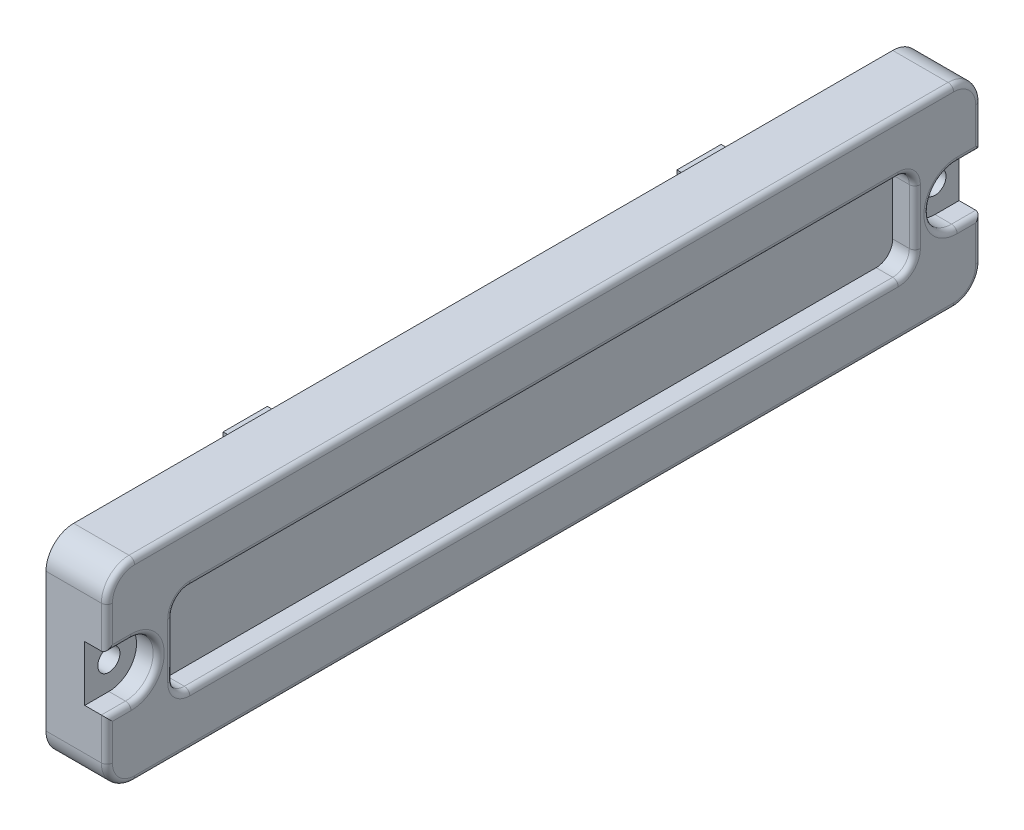
from build123d import *

# Parameters (mm, degrees)
EXTRUIR1_DEPTH            = 5.5
EXTRUIR2_DEPTH            = 2
EXTRUIR3_DEPTH            = 2
CROQUIS5_R                = 1
EXTRUIR4_DEPTH            = 41.608650556
REDONDEO1_R               = 0.5
VACIADO1_DEPTH            = 2
VACIADO1_START            = 2
VACIADO1_2_DEPTH          = 2
CROQUIS7_R                = 0.35
EXTRUIR6_DEPTH            = 0.1
MATRIZL1_START            = 1.9
MATRIZL1_OUTLINE_R        = 0.35
MATRIZL1_DEPTH            = 0.1
CROQUIS8_W                = 4
CROQUIS8_H                = 1
EXTRUIR7_DEPTH            = 5
SIMETR_A3_COPY_1_SKETCH_W = 4
SIMETR_A3_COPY_1_SKETCH_H = 1
SIMETR_A3_COPY_1_DEPTH    = 5


with BuildPart() as part:
    # Croquis2 → Extruir1 (new body)
    with BuildSketch(Plane(origin=(0, 0, 0), x_dir=(0, 0, -1), z_dir=(1, 0, 0))):
        with BuildLine():
            Line((-37, 8.75), (37, 8.75))
            ThreePointArc((37, 8.75), (38.767766953, 8.017766953), (39.5, 6.25))
            Line((39.5, 6.25), (39.5, -6.25))
            ThreePointArc((39.5, -6.25), (38.767766953, -8.017766953), (37, -8.75))
            Line((37, -8.75), (-37, -8.75))
            ThreePointArc((-37, -8.75), (-38.767766953, -8.017766953), (-39.5, -6.25))
            Line((-39.5, -6.25), (-39.5, 6.25))
            ThreePointArc((-39.5, 6.25), (-38.767766953, 8.017766953), (-37, 8.75))
        make_face()
    extrude(amount=EXTRUIR1_DEPTH)

    # Croquis3 → Extruir2 (cut)
    with BuildSketch(Plane(origin=(5.5, 0, 0), x_dir=(0, 0, -1), z_dir=(1, 0, 0))):
        with BuildLine():
            Line((-32, 4), (32, 4))
            ThreePointArc((32, 4), (33.060660172, 3.560660172), (33.5, 2.5))
            Line((33.5, 2.5), (33.5, -2.5))
            ThreePointArc((33.5, -2.5), (33.060660172, -3.560660172), (32, -4))
            Line((32, -4), (-32, -4))
            ThreePointArc((-32, -4), (-33.060660172, -3.560660172), (-33.5, -2.5))
            Line((-33.5, -2.5), (-33.5, 2.5))
            ThreePointArc((-33.5, 2.5), (-33.060660172, 3.560660172), (-32, 4))
        make_face()
    extrude(amount=-EXTRUIR2_DEPTH, mode=Mode.SUBTRACT)

    # Croquis4 → Extruir3 (cut)
    with BuildSketch(Plane(origin=(5.5, 0, 0), x_dir=(0, 0, -1), z_dir=(1, 0, 0))):
        with BuildLine():
            Line((-39.5, 2.5), (-37.32, 2.5))
            ThreePointArc((-37.32, 2.5), (-34.82, 0), (-37.32, -2.5))
            Line((-37.32, -2.5), (-39.5, -2.5))
            Line((-39.5, -2.5), (-39.5, 2.5))
        make_face()
    extruir3 = extrude(amount=-EXTRUIR3_DEPTH, mode=Mode.SUBTRACT)

    # Croquis5 → Extruir4 (cut, through all)
    with BuildSketch(Plane(origin=(3.5, 0, 0), x_dir=(0, 0, -1), z_dir=(1, 0, 0))):
        with Locations((-37.32, 0)):
            Circle(CROQUIS5_R)
    extruir4 = extrude(amount=-EXTRUIR4_DEPTH, mode=Mode.SUBTRACT)

    # Simetría1: Extruir3, Extruir4 across plane
    add(extruir3.mirror(Plane.XY), mode=Mode.SUBTRACT)
    add(extruir4.mirror(Plane.XY), mode=Mode.SUBTRACT)

    # Redondeo1
    redondeo1_edges = [part.edges().sort_by_distance(p)[0] for p in [
        (5.5, -8.017766953, 38.767766953),
        (5.5, -8.75, 0),
        (5.5, -8.017766953, -38.767766953),
        (5.5, -4.375, -39.5),
        (5.5, 8.017766953, -38.767766953),
        (5.5, 8.75, 0),
        (5.5, 8.017766953, 38.767766953),
        (5.5, 3.560660172, 33.060660172),
        (5.5, 0, 33.5),
        (5.5, -3.560660172, 33.060660172),
        (5.5, -4, 0),
        (5.5, -3.560660172, -33.060660172),
        (5.5, 0, -33.5),
        (5.5, 3.560660172, -33.060660172),
        (5.5, 4, 0),
        (5.5, -4.375, 39.5),
        (5.5, -2.5, 38.41),
        (5.5, 0, 34.82),
        (5.5, 2.5, 38.41),
        (5.5, 4.375, 39.5),
        (5.5, 4.375, -39.5),
        (5.5, -2.5, -38.41),
        (5.5, 0, -34.82),
        (5.5, 2.5, -38.41),
    ]]
    fillet(redondeo1_edges, radius=REDONDEO1_R)

    # Vaciado1: read off the stored shape, not the designer's step
    # Vaciado1 outline → Vaciado1 (cut)
    with BuildSketch(Plane.YZ):
        with BuildLine():
            Line((-2.405743128, 38), (-6.25, 38))
            ThreePointArc((-6.25, 38), (-6.957106781, 37.707106781), (-7.25, 37))
            Line((-7.25, 37), (-7.25, -37))
            ThreePointArc((-7.25, -37), (-6.957106781, -37.707106781), (-6.25, -38))
            Line((-6.25, -38), (-2.405743128, -38))
            ThreePointArc((-2.405743128, -38), (0, -34.82), (2.405743128, -38))
            Line((2.405743128, -38), (6.25, -38))
            ThreePointArc((6.25, -38), (6.957106781, -37.707106781), (7.25, -37))
            Line((7.25, -37), (7.25, 37))
            ThreePointArc((7.25, 37), (6.957106781, 37.707106781), (6.25, 38))
            Line((6.25, 38), (2.405743128, 38))
            ThreePointArc((2.405743128, 38), (0, 34.82), (-2.405743128, 38))
        make_face()
    extrude(amount=VACIADO1_DEPTH, mode=Mode.SUBTRACT)

    # Vaciado1 2 outline → Vaciado1 2 (cut)
    with BuildSketch(Plane.YZ.offset(VACIADO1_START)):
        with BuildLine():
            ThreePointArc((-4, -37.32), (-3.794262159, -36.053676712), (-3.198212665, -34.917618734))
            ThreePointArc((-3.198212665, -34.917618734), (-4.855274718, -33.858139124), (-5.5, -32))
            Line((-5.5, -32), (-5.5, 32))
            ThreePointArc((-5.5, 32), (-4.855274718, 33.858139124), (-3.198212665, 34.917618734))
            ThreePointArc((-3.198212665, 34.917618734), (-3.794262159, 36.053676712), (-4, 37.32))
            Line((-4, 37.32), (-4, 38))
            Line((-4, 38), (-6.25, 38))
            ThreePointArc((-6.25, 38), (-6.957106781, 37.707106781), (-7.25, 37))
            Line((-7.25, 37), (-7.25, -37))
            ThreePointArc((-7.25, -37), (-6.957106781, -37.707106781), (-6.25, -38))
            Line((-6.25, -38), (-4, -38))
            Line((-4, -38), (-4, -37.32))
        make_face()
        with BuildLine():
            Line((4, -37.32), (4, -38))
            Line((4, -38), (6.25, -38))
            ThreePointArc((6.25, -38), (6.957106781, -37.707106781), (7.25, -37))
            Line((7.25, -37), (7.25, 37))
            ThreePointArc((7.25, 37), (6.957106781, 37.707106781), (6.25, 38))
            Line((6.25, 38), (4, 38))
            Line((4, 38), (4, 37.32))
            ThreePointArc((4, 37.32), (3.794262159, 36.053676712), (3.198212665, 34.917618734))
            ThreePointArc((3.198212665, 34.917618734), (4.855274718, 33.858139124), (5.5, 32))
            Line((5.5, 32), (5.5, -32))
            ThreePointArc((5.5, -32), (4.855274718, -33.858139124), (3.198212665, -34.917618734))
            ThreePointArc((3.198212665, -34.917618734), (3.794262159, -36.053676712), (4, -37.32))
        make_face()
    extrude(amount=VACIADO1_2_DEPTH, mode=Mode.SUBTRACT)

    # Croquis7 → Extruir6 (add)
    with BuildSketch(Plane.ZY.offset(-2)):
        with Locations((-31.830162844, 2.25)):
            Circle(CROQUIS7_R)
    extrude(amount=EXTRUIR6_DEPTH)

    # MatrizL1: read off the stored shape, not the designer's step
    # MatrizL1 outline → MatrizL1 (add)
    with BuildSketch(Plane.YZ.offset(MATRIZL1_START)):
        with Locations((2.25, -30.830162844)):
            Circle(MATRIZL1_OUTLINE_R)
        with Locations((2.25, -29.830162844)):
            Circle(MATRIZL1_OUTLINE_R)
        with Locations((2.25, -28.830162844)):
            Circle(MATRIZL1_OUTLINE_R)
        with Locations((2.25, -27.830162844)):
            Circle(MATRIZL1_OUTLINE_R)
        with Locations((2.25, -26.830162844)):
            Circle(MATRIZL1_OUTLINE_R)
        with Locations((2.25, -25.830162844)):
            Circle(MATRIZL1_OUTLINE_R)
        with Locations((2.25, -24.830162844)):
            Circle(MATRIZL1_OUTLINE_R)
        with Locations((2.25, -23.830162844)):
            Circle(MATRIZL1_OUTLINE_R)
        with Locations((2.25, -22.830162844)):
            Circle(MATRIZL1_OUTLINE_R)
        with Locations((2.25, -21.830162844)):
            Circle(MATRIZL1_OUTLINE_R)
        with Locations((2.25, -20.830162844)):
            Circle(MATRIZL1_OUTLINE_R)
        with Locations((2.25, -19.830162844)):
            Circle(MATRIZL1_OUTLINE_R)
        with Locations((2.25, -18.830162844)):
            Circle(MATRIZL1_OUTLINE_R)
        with Locations((2.25, -17.830162844)):
            Circle(MATRIZL1_OUTLINE_R)
        with Locations((2.25, -16.830162844)):
            Circle(MATRIZL1_OUTLINE_R)
        with Locations((2.25, -15.830162844)):
            Circle(MATRIZL1_OUTLINE_R)
        with Locations((2.25, -14.830162844)):
            Circle(MATRIZL1_OUTLINE_R)
        with Locations((2.25, -13.830162844)):
            Circle(MATRIZL1_OUTLINE_R)
        with Locations((2.25, -12.830162844)):
            Circle(MATRIZL1_OUTLINE_R)
        with Locations((2.25, -11.830162844)):
            Circle(MATRIZL1_OUTLINE_R)
        with Locations((2.25, -10.830162844)):
            Circle(MATRIZL1_OUTLINE_R)
        with Locations((2.25, -9.830162844)):
            Circle(MATRIZL1_OUTLINE_R)
        with Locations((2.25, -8.830162844)):
            Circle(MATRIZL1_OUTLINE_R)
        with Locations((2.25, -7.830162844)):
            Circle(MATRIZL1_OUTLINE_R)
        with Locations((2.25, -6.830162844)):
            Circle(MATRIZL1_OUTLINE_R)
        with Locations((2.25, -5.830162844)):
            Circle(MATRIZL1_OUTLINE_R)
        with Locations((2.25, -4.830162844)):
            Circle(MATRIZL1_OUTLINE_R)
        with Locations((2.25, -3.830162844)):
            Circle(MATRIZL1_OUTLINE_R)
        with Locations((2.25, -2.830162844)):
            Circle(MATRIZL1_OUTLINE_R)
        with Locations((2.25, -1.830162844)):
            Circle(MATRIZL1_OUTLINE_R)
        with Locations((2.25, -0.830162844)):
            Circle(MATRIZL1_OUTLINE_R)
        with Locations((2.25, 0.169837156)):
            Circle(MATRIZL1_OUTLINE_R)
        with Locations((2.25, 1.169837156)):
            Circle(MATRIZL1_OUTLINE_R)
        with Locations((2.25, 2.169837156)):
            Circle(MATRIZL1_OUTLINE_R)
        with Locations((2.25, 3.169837156)):
            Circle(MATRIZL1_OUTLINE_R)
        with Locations((2.25, 4.169837156)):
            Circle(MATRIZL1_OUTLINE_R)
        with Locations((2.25, 5.169837156)):
            Circle(MATRIZL1_OUTLINE_R)
        with Locations((2.25, 6.169837156)):
            Circle(MATRIZL1_OUTLINE_R)
        with Locations((2.25, 7.169837156)):
            Circle(MATRIZL1_OUTLINE_R)
        with Locations((2.25, 8.169837156)):
            Circle(MATRIZL1_OUTLINE_R)
        with Locations((2.25, 9.169837156)):
            Circle(MATRIZL1_OUTLINE_R)
        with Locations((2.25, 10.169837156)):
            Circle(MATRIZL1_OUTLINE_R)
        with Locations((2.25, 11.169837156)):
            Circle(MATRIZL1_OUTLINE_R)
        with Locations((2.25, 12.169837156)):
            Circle(MATRIZL1_OUTLINE_R)
        with Locations((2.25, 13.169837156)):
            Circle(MATRIZL1_OUTLINE_R)
        with Locations((2.25, 14.169837156)):
            Circle(MATRIZL1_OUTLINE_R)
        with Locations((2.25, 15.169837156)):
            Circle(MATRIZL1_OUTLINE_R)
        with Locations((2.25, 16.169837156)):
            Circle(MATRIZL1_OUTLINE_R)
        with Locations((2.25, 17.169837156)):
            Circle(MATRIZL1_OUTLINE_R)
        with Locations((2.25, 18.169837156)):
            Circle(MATRIZL1_OUTLINE_R)
        with Locations((2.25, 19.169837156)):
            Circle(MATRIZL1_OUTLINE_R)
        with Locations((2.25, 20.169837156)):
            Circle(MATRIZL1_OUTLINE_R)
        with Locations((2.25, 21.169837156)):
            Circle(MATRIZL1_OUTLINE_R)
        with Locations((2.25, 22.169837156)):
            Circle(MATRIZL1_OUTLINE_R)
        with Locations((2.25, 23.169837156)):
            Circle(MATRIZL1_OUTLINE_R)
        with Locations((2.25, 24.169837156)):
            Circle(MATRIZL1_OUTLINE_R)
        with Locations((2.25, 25.169837156)):
            Circle(MATRIZL1_OUTLINE_R)
        with Locations((2.25, 26.169837156)):
            Circle(MATRIZL1_OUTLINE_R)
        with Locations((2.25, 27.169837156)):
            Circle(MATRIZL1_OUTLINE_R)
        with Locations((2.25, 28.169837156)):
            Circle(MATRIZL1_OUTLINE_R)
        with Locations((2.25, 29.169837156)):
            Circle(MATRIZL1_OUTLINE_R)
        with Locations((2.25, 30.169837156)):
            Circle(MATRIZL1_OUTLINE_R)
        with Locations((2.25, 31.169837156)):
            Circle(MATRIZL1_OUTLINE_R)
        with Locations((1.25, -31.830162844)):
            Circle(MATRIZL1_OUTLINE_R)
        with Locations((1.25, -30.830162844)):
            Circle(MATRIZL1_OUTLINE_R)
        with Locations((1.25, -29.830162844)):
            Circle(MATRIZL1_OUTLINE_R)
        with Locations((1.25, -28.830162844)):
            Circle(MATRIZL1_OUTLINE_R)
        with Locations((1.25, -27.830162844)):
            Circle(MATRIZL1_OUTLINE_R)
        with Locations((1.25, -26.830162844)):
            Circle(MATRIZL1_OUTLINE_R)
        with Locations((1.25, -25.830162844)):
            Circle(MATRIZL1_OUTLINE_R)
        with Locations((1.25, -24.830162844)):
            Circle(MATRIZL1_OUTLINE_R)
        with Locations((1.25, -23.830162844)):
            Circle(MATRIZL1_OUTLINE_R)
        with Locations((1.25, -22.830162844)):
            Circle(MATRIZL1_OUTLINE_R)
        with Locations((1.25, -21.830162844)):
            Circle(MATRIZL1_OUTLINE_R)
        with Locations((1.25, -20.830162844)):
            Circle(MATRIZL1_OUTLINE_R)
        with Locations((1.25, -19.830162844)):
            Circle(MATRIZL1_OUTLINE_R)
        with Locations((1.25, -18.830162844)):
            Circle(MATRIZL1_OUTLINE_R)
        with Locations((1.25, -17.830162844)):
            Circle(MATRIZL1_OUTLINE_R)
        with Locations((1.25, -16.830162844)):
            Circle(MATRIZL1_OUTLINE_R)
        with Locations((1.25, -15.830162844)):
            Circle(MATRIZL1_OUTLINE_R)
        with Locations((1.25, -14.830162844)):
            Circle(MATRIZL1_OUTLINE_R)
        with Locations((1.25, -13.830162844)):
            Circle(MATRIZL1_OUTLINE_R)
        with Locations((1.25, -12.830162844)):
            Circle(MATRIZL1_OUTLINE_R)
        with Locations((1.25, -11.830162844)):
            Circle(MATRIZL1_OUTLINE_R)
        with Locations((1.25, -10.830162844)):
            Circle(MATRIZL1_OUTLINE_R)
        with Locations((1.25, -9.830162844)):
            Circle(MATRIZL1_OUTLINE_R)
        with Locations((1.25, -8.830162844)):
            Circle(MATRIZL1_OUTLINE_R)
        with Locations((1.25, -7.830162844)):
            Circle(MATRIZL1_OUTLINE_R)
        with Locations((1.25, -6.830162844)):
            Circle(MATRIZL1_OUTLINE_R)
        with Locations((1.25, -5.830162844)):
            Circle(MATRIZL1_OUTLINE_R)
        with Locations((1.25, -4.830162844)):
            Circle(MATRIZL1_OUTLINE_R)
        with Locations((1.25, -3.830162844)):
            Circle(MATRIZL1_OUTLINE_R)
        with Locations((1.25, -2.830162844)):
            Circle(MATRIZL1_OUTLINE_R)
        with Locations((1.25, -1.830162844)):
            Circle(MATRIZL1_OUTLINE_R)
        with Locations((1.25, -0.830162844)):
            Circle(MATRIZL1_OUTLINE_R)
        with Locations((1.25, 0.169837156)):
            Circle(MATRIZL1_OUTLINE_R)
        with Locations((1.25, 1.169837156)):
            Circle(MATRIZL1_OUTLINE_R)
        with Locations((1.25, 2.169837156)):
            Circle(MATRIZL1_OUTLINE_R)
        with Locations((1.25, 3.169837156)):
            Circle(MATRIZL1_OUTLINE_R)
        with Locations((1.25, 4.169837156)):
            Circle(MATRIZL1_OUTLINE_R)
        with Locations((1.25, 5.169837156)):
            Circle(MATRIZL1_OUTLINE_R)
        with Locations((1.25, 6.169837156)):
            Circle(MATRIZL1_OUTLINE_R)
        with Locations((1.25, 7.169837156)):
            Circle(MATRIZL1_OUTLINE_R)
        with Locations((1.25, 8.169837156)):
            Circle(MATRIZL1_OUTLINE_R)
        with Locations((1.25, 9.169837156)):
            Circle(MATRIZL1_OUTLINE_R)
        with Locations((1.25, 10.169837156)):
            Circle(MATRIZL1_OUTLINE_R)
        with Locations((1.25, 11.169837156)):
            Circle(MATRIZL1_OUTLINE_R)
        with Locations((1.25, 12.169837156)):
            Circle(MATRIZL1_OUTLINE_R)
        with Locations((1.25, 13.169837156)):
            Circle(MATRIZL1_OUTLINE_R)
        with Locations((1.25, 14.169837156)):
            Circle(MATRIZL1_OUTLINE_R)
        with Locations((1.25, 15.169837156)):
            Circle(MATRIZL1_OUTLINE_R)
        with Locations((1.25, 16.169837156)):
            Circle(MATRIZL1_OUTLINE_R)
        with Locations((1.25, 17.169837156)):
            Circle(MATRIZL1_OUTLINE_R)
        with Locations((1.25, 18.169837156)):
            Circle(MATRIZL1_OUTLINE_R)
        with Locations((1.25, 19.169837156)):
            Circle(MATRIZL1_OUTLINE_R)
        with Locations((1.25, 20.169837156)):
            Circle(MATRIZL1_OUTLINE_R)
        with Locations((1.25, 21.169837156)):
            Circle(MATRIZL1_OUTLINE_R)
        with Locations((1.25, 22.169837156)):
            Circle(MATRIZL1_OUTLINE_R)
        with Locations((1.25, 23.169837156)):
            Circle(MATRIZL1_OUTLINE_R)
        with Locations((1.25, 24.169837156)):
            Circle(MATRIZL1_OUTLINE_R)
        with Locations((1.25, 25.169837156)):
            Circle(MATRIZL1_OUTLINE_R)
        with Locations((1.25, 26.169837156)):
            Circle(MATRIZL1_OUTLINE_R)
        with Locations((1.25, 27.169837156)):
            Circle(MATRIZL1_OUTLINE_R)
        with Locations((1.25, 28.169837156)):
            Circle(MATRIZL1_OUTLINE_R)
        with Locations((1.25, 29.169837156)):
            Circle(MATRIZL1_OUTLINE_R)
        with Locations((1.25, 30.169837156)):
            Circle(MATRIZL1_OUTLINE_R)
        with Locations((1.25, 31.169837156)):
            Circle(MATRIZL1_OUTLINE_R)
        with Locations((0.25, -31.830162844)):
            Circle(MATRIZL1_OUTLINE_R)
        with Locations((0.25, -30.830162844)):
            Circle(MATRIZL1_OUTLINE_R)
        with Locations((0.25, -29.830162844)):
            Circle(MATRIZL1_OUTLINE_R)
        with Locations((0.25, -28.830162844)):
            Circle(MATRIZL1_OUTLINE_R)
        with Locations((0.25, -27.830162844)):
            Circle(MATRIZL1_OUTLINE_R)
        with Locations((0.25, -26.830162844)):
            Circle(MATRIZL1_OUTLINE_R)
        with Locations((0.25, -25.830162844)):
            Circle(MATRIZL1_OUTLINE_R)
        with Locations((0.25, -24.830162844)):
            Circle(MATRIZL1_OUTLINE_R)
        with Locations((0.25, -23.830162844)):
            Circle(MATRIZL1_OUTLINE_R)
        with Locations((0.25, -22.830162844)):
            Circle(MATRIZL1_OUTLINE_R)
        with Locations((0.25, -21.830162844)):
            Circle(MATRIZL1_OUTLINE_R)
        with Locations((0.25, -20.830162844)):
            Circle(MATRIZL1_OUTLINE_R)
        with Locations((0.25, -19.830162844)):
            Circle(MATRIZL1_OUTLINE_R)
        with Locations((0.25, -18.830162844)):
            Circle(MATRIZL1_OUTLINE_R)
        with Locations((0.25, -17.830162844)):
            Circle(MATRIZL1_OUTLINE_R)
        with Locations((0.25, -16.830162844)):
            Circle(MATRIZL1_OUTLINE_R)
        with Locations((0.25, -15.830162844)):
            Circle(MATRIZL1_OUTLINE_R)
        with Locations((0.25, -14.830162844)):
            Circle(MATRIZL1_OUTLINE_R)
        with Locations((0.25, -13.830162844)):
            Circle(MATRIZL1_OUTLINE_R)
        with Locations((0.25, -12.830162844)):
            Circle(MATRIZL1_OUTLINE_R)
        with Locations((0.25, -11.830162844)):
            Circle(MATRIZL1_OUTLINE_R)
        with Locations((0.25, -10.830162844)):
            Circle(MATRIZL1_OUTLINE_R)
        with Locations((0.25, -9.830162844)):
            Circle(MATRIZL1_OUTLINE_R)
        with Locations((0.25, -8.830162844)):
            Circle(MATRIZL1_OUTLINE_R)
        with Locations((0.25, -7.830162844)):
            Circle(MATRIZL1_OUTLINE_R)
        with Locations((0.25, -6.830162844)):
            Circle(MATRIZL1_OUTLINE_R)
        with Locations((0.25, -5.830162844)):
            Circle(MATRIZL1_OUTLINE_R)
        with Locations((0.25, -4.830162844)):
            Circle(MATRIZL1_OUTLINE_R)
        with Locations((0.25, -3.830162844)):
            Circle(MATRIZL1_OUTLINE_R)
        with Locations((0.25, -2.830162844)):
            Circle(MATRIZL1_OUTLINE_R)
        with Locations((0.25, -1.830162844)):
            Circle(MATRIZL1_OUTLINE_R)
        with Locations((0.25, -0.830162844)):
            Circle(MATRIZL1_OUTLINE_R)
        with Locations((0.25, 0.169837156)):
            Circle(MATRIZL1_OUTLINE_R)
        with Locations((0.25, 1.169837156)):
            Circle(MATRIZL1_OUTLINE_R)
        with Locations((0.25, 2.169837156)):
            Circle(MATRIZL1_OUTLINE_R)
        with Locations((0.25, 3.169837156)):
            Circle(MATRIZL1_OUTLINE_R)
        with Locations((0.25, 4.169837156)):
            Circle(MATRIZL1_OUTLINE_R)
        with Locations((0.25, 5.169837156)):
            Circle(MATRIZL1_OUTLINE_R)
        with Locations((0.25, 6.169837156)):
            Circle(MATRIZL1_OUTLINE_R)
        with Locations((0.25, 7.169837156)):
            Circle(MATRIZL1_OUTLINE_R)
        with Locations((0.25, 8.169837156)):
            Circle(MATRIZL1_OUTLINE_R)
        with Locations((0.25, 9.169837156)):
            Circle(MATRIZL1_OUTLINE_R)
        with Locations((0.25, 10.169837156)):
            Circle(MATRIZL1_OUTLINE_R)
        with Locations((0.25, 11.169837156)):
            Circle(MATRIZL1_OUTLINE_R)
        with Locations((0.25, 12.169837156)):
            Circle(MATRIZL1_OUTLINE_R)
        with Locations((0.25, 13.169837156)):
            Circle(MATRIZL1_OUTLINE_R)
        with Locations((0.25, 14.169837156)):
            Circle(MATRIZL1_OUTLINE_R)
        with Locations((0.25, 15.169837156)):
            Circle(MATRIZL1_OUTLINE_R)
        with Locations((0.25, 16.169837156)):
            Circle(MATRIZL1_OUTLINE_R)
        with Locations((0.25, 17.169837156)):
            Circle(MATRIZL1_OUTLINE_R)
        with Locations((0.25, 18.169837156)):
            Circle(MATRIZL1_OUTLINE_R)
        with Locations((0.25, 19.169837156)):
            Circle(MATRIZL1_OUTLINE_R)
        with Locations((0.25, 20.169837156)):
            Circle(MATRIZL1_OUTLINE_R)
        with Locations((0.25, 21.169837156)):
            Circle(MATRIZL1_OUTLINE_R)
        with Locations((0.25, 22.169837156)):
            Circle(MATRIZL1_OUTLINE_R)
        with Locations((0.25, 23.169837156)):
            Circle(MATRIZL1_OUTLINE_R)
        with Locations((0.25, 24.169837156)):
            Circle(MATRIZL1_OUTLINE_R)
        with Locations((0.25, 25.169837156)):
            Circle(MATRIZL1_OUTLINE_R)
        with Locations((0.25, 26.169837156)):
            Circle(MATRIZL1_OUTLINE_R)
        with Locations((0.25, 27.169837156)):
            Circle(MATRIZL1_OUTLINE_R)
        with Locations((0.25, 28.169837156)):
            Circle(MATRIZL1_OUTLINE_R)
        with Locations((0.25, 29.169837156)):
            Circle(MATRIZL1_OUTLINE_R)
        with Locations((0.25, 30.169837156)):
            Circle(MATRIZL1_OUTLINE_R)
        with Locations((0.25, 31.169837156)):
            Circle(MATRIZL1_OUTLINE_R)
        with Locations((-0.75, -31.830162844)):
            Circle(MATRIZL1_OUTLINE_R)
        with Locations((-0.75, -30.830162844)):
            Circle(MATRIZL1_OUTLINE_R)
        with Locations((-0.75, -29.830162844)):
            Circle(MATRIZL1_OUTLINE_R)
        with Locations((-0.75, -28.830162844)):
            Circle(MATRIZL1_OUTLINE_R)
        with Locations((-0.75, -27.830162844)):
            Circle(MATRIZL1_OUTLINE_R)
        with Locations((-0.75, -26.830162844)):
            Circle(MATRIZL1_OUTLINE_R)
        with Locations((-0.75, -25.830162844)):
            Circle(MATRIZL1_OUTLINE_R)
        with Locations((-0.75, -24.830162844)):
            Circle(MATRIZL1_OUTLINE_R)
        with Locations((-0.75, -23.830162844)):
            Circle(MATRIZL1_OUTLINE_R)
        with Locations((-0.75, -22.830162844)):
            Circle(MATRIZL1_OUTLINE_R)
        with Locations((-0.75, -21.830162844)):
            Circle(MATRIZL1_OUTLINE_R)
        with Locations((-0.75, -20.830162844)):
            Circle(MATRIZL1_OUTLINE_R)
        with Locations((-0.75, -19.830162844)):
            Circle(MATRIZL1_OUTLINE_R)
        with Locations((-0.75, -18.830162844)):
            Circle(MATRIZL1_OUTLINE_R)
        with Locations((-0.75, -17.830162844)):
            Circle(MATRIZL1_OUTLINE_R)
        with Locations((-0.75, -16.830162844)):
            Circle(MATRIZL1_OUTLINE_R)
        with Locations((-0.75, -15.830162844)):
            Circle(MATRIZL1_OUTLINE_R)
        with Locations((-0.75, -14.830162844)):
            Circle(MATRIZL1_OUTLINE_R)
        with Locations((-0.75, -13.830162844)):
            Circle(MATRIZL1_OUTLINE_R)
        with Locations((-0.75, -12.830162844)):
            Circle(MATRIZL1_OUTLINE_R)
        with Locations((-0.75, -11.830162844)):
            Circle(MATRIZL1_OUTLINE_R)
        with Locations((-0.75, -10.830162844)):
            Circle(MATRIZL1_OUTLINE_R)
        with Locations((-0.75, -9.830162844)):
            Circle(MATRIZL1_OUTLINE_R)
        with Locations((-0.75, -8.830162844)):
            Circle(MATRIZL1_OUTLINE_R)
        with Locations((-0.75, -7.830162844)):
            Circle(MATRIZL1_OUTLINE_R)
        with Locations((-0.75, -6.830162844)):
            Circle(MATRIZL1_OUTLINE_R)
        with Locations((-0.75, -5.830162844)):
            Circle(MATRIZL1_OUTLINE_R)
        with Locations((-0.75, -4.830162844)):
            Circle(MATRIZL1_OUTLINE_R)
        with Locations((-0.75, -3.830162844)):
            Circle(MATRIZL1_OUTLINE_R)
        with Locations((-0.75, -2.830162844)):
            Circle(MATRIZL1_OUTLINE_R)
        with Locations((-0.75, -1.830162844)):
            Circle(MATRIZL1_OUTLINE_R)
        with Locations((-0.75, -0.830162844)):
            Circle(MATRIZL1_OUTLINE_R)
        with Locations((-0.75, 0.169837156)):
            Circle(MATRIZL1_OUTLINE_R)
        with Locations((-0.75, 1.169837156)):
            Circle(MATRIZL1_OUTLINE_R)
        with Locations((-0.75, 2.169837156)):
            Circle(MATRIZL1_OUTLINE_R)
        with Locations((-0.75, 3.169837156)):
            Circle(MATRIZL1_OUTLINE_R)
        with Locations((-0.75, 4.169837156)):
            Circle(MATRIZL1_OUTLINE_R)
        with Locations((-0.75, 5.169837156)):
            Circle(MATRIZL1_OUTLINE_R)
        with Locations((-0.75, 6.169837156)):
            Circle(MATRIZL1_OUTLINE_R)
        with Locations((-0.75, 7.169837156)):
            Circle(MATRIZL1_OUTLINE_R)
        with Locations((-0.75, 8.169837156)):
            Circle(MATRIZL1_OUTLINE_R)
        with Locations((-0.75, 9.169837156)):
            Circle(MATRIZL1_OUTLINE_R)
        with Locations((-0.75, 10.169837156)):
            Circle(MATRIZL1_OUTLINE_R)
        with Locations((-0.75, 11.169837156)):
            Circle(MATRIZL1_OUTLINE_R)
        with Locations((-0.75, 12.169837156)):
            Circle(MATRIZL1_OUTLINE_R)
        with Locations((-0.75, 13.169837156)):
            Circle(MATRIZL1_OUTLINE_R)
        with Locations((-0.75, 14.169837156)):
            Circle(MATRIZL1_OUTLINE_R)
        with Locations((-0.75, 15.169837156)):
            Circle(MATRIZL1_OUTLINE_R)
        with Locations((-0.75, 16.169837156)):
            Circle(MATRIZL1_OUTLINE_R)
        with Locations((-0.75, 17.169837156)):
            Circle(MATRIZL1_OUTLINE_R)
        with Locations((-0.75, 18.169837156)):
            Circle(MATRIZL1_OUTLINE_R)
        with Locations((-0.75, 19.169837156)):
            Circle(MATRIZL1_OUTLINE_R)
        with Locations((-0.75, 20.169837156)):
            Circle(MATRIZL1_OUTLINE_R)
        with Locations((-0.75, 21.169837156)):
            Circle(MATRIZL1_OUTLINE_R)
        with Locations((-0.75, 22.169837156)):
            Circle(MATRIZL1_OUTLINE_R)
        with Locations((-0.75, 23.169837156)):
            Circle(MATRIZL1_OUTLINE_R)
        with Locations((-0.75, 24.169837156)):
            Circle(MATRIZL1_OUTLINE_R)
        with Locations((-0.75, 25.169837156)):
            Circle(MATRIZL1_OUTLINE_R)
        with Locations((-0.75, 26.169837156)):
            Circle(MATRIZL1_OUTLINE_R)
        with Locations((-0.75, 27.169837156)):
            Circle(MATRIZL1_OUTLINE_R)
        with Locations((-0.75, 28.169837156)):
            Circle(MATRIZL1_OUTLINE_R)
        with Locations((-0.75, 29.169837156)):
            Circle(MATRIZL1_OUTLINE_R)
        with Locations((-0.75, 30.169837156)):
            Circle(MATRIZL1_OUTLINE_R)
        with Locations((-0.75, 31.169837156)):
            Circle(MATRIZL1_OUTLINE_R)
        with Locations((-1.75, -31.830162844)):
            Circle(MATRIZL1_OUTLINE_R)
        with Locations((-1.75, -30.830162844)):
            Circle(MATRIZL1_OUTLINE_R)
        with Locations((-1.75, -29.830162844)):
            Circle(MATRIZL1_OUTLINE_R)
        with Locations((-1.75, -28.830162844)):
            Circle(MATRIZL1_OUTLINE_R)
        with Locations((-1.75, -27.830162844)):
            Circle(MATRIZL1_OUTLINE_R)
        with Locations((-1.75, -26.830162844)):
            Circle(MATRIZL1_OUTLINE_R)
        with Locations((-1.75, -25.830162844)):
            Circle(MATRIZL1_OUTLINE_R)
        with Locations((-1.75, -24.830162844)):
            Circle(MATRIZL1_OUTLINE_R)
        with Locations((-1.75, -23.830162844)):
            Circle(MATRIZL1_OUTLINE_R)
        with Locations((-1.75, -22.830162844)):
            Circle(MATRIZL1_OUTLINE_R)
        with Locations((-1.75, -21.830162844)):
            Circle(MATRIZL1_OUTLINE_R)
        with Locations((-1.75, -20.830162844)):
            Circle(MATRIZL1_OUTLINE_R)
        with Locations((-1.75, -19.830162844)):
            Circle(MATRIZL1_OUTLINE_R)
        with Locations((-1.75, -18.830162844)):
            Circle(MATRIZL1_OUTLINE_R)
        with Locations((-1.75, -17.830162844)):
            Circle(MATRIZL1_OUTLINE_R)
        with Locations((-1.75, -16.830162844)):
            Circle(MATRIZL1_OUTLINE_R)
        with Locations((-1.75, -15.830162844)):
            Circle(MATRIZL1_OUTLINE_R)
        with Locations((-1.75, -14.830162844)):
            Circle(MATRIZL1_OUTLINE_R)
        with Locations((-1.75, -13.830162844)):
            Circle(MATRIZL1_OUTLINE_R)
        with Locations((-1.75, -12.830162844)):
            Circle(MATRIZL1_OUTLINE_R)
        with Locations((-1.75, -11.830162844)):
            Circle(MATRIZL1_OUTLINE_R)
        with Locations((-1.75, -10.830162844)):
            Circle(MATRIZL1_OUTLINE_R)
        with Locations((-1.75, -9.830162844)):
            Circle(MATRIZL1_OUTLINE_R)
        with Locations((-1.75, -8.830162844)):
            Circle(MATRIZL1_OUTLINE_R)
        with Locations((-1.75, -7.830162844)):
            Circle(MATRIZL1_OUTLINE_R)
        with Locations((-1.75, -6.830162844)):
            Circle(MATRIZL1_OUTLINE_R)
        with Locations((-1.75, -5.830162844)):
            Circle(MATRIZL1_OUTLINE_R)
        with Locations((-1.75, -4.830162844)):
            Circle(MATRIZL1_OUTLINE_R)
        with Locations((-1.75, -3.830162844)):
            Circle(MATRIZL1_OUTLINE_R)
        with Locations((-1.75, -2.830162844)):
            Circle(MATRIZL1_OUTLINE_R)
        with Locations((-1.75, -1.830162844)):
            Circle(MATRIZL1_OUTLINE_R)
        with Locations((-1.75, -0.830162844)):
            Circle(MATRIZL1_OUTLINE_R)
        with Locations((-1.75, 0.169837156)):
            Circle(MATRIZL1_OUTLINE_R)
        with Locations((-1.75, 1.169837156)):
            Circle(MATRIZL1_OUTLINE_R)
        with Locations((-1.75, 2.169837156)):
            Circle(MATRIZL1_OUTLINE_R)
        with Locations((-1.75, 3.169837156)):
            Circle(MATRIZL1_OUTLINE_R)
        with Locations((-1.75, 4.169837156)):
            Circle(MATRIZL1_OUTLINE_R)
        with Locations((-1.75, 5.169837156)):
            Circle(MATRIZL1_OUTLINE_R)
        with Locations((-1.75, 6.169837156)):
            Circle(MATRIZL1_OUTLINE_R)
        with Locations((-1.75, 7.169837156)):
            Circle(MATRIZL1_OUTLINE_R)
        with Locations((-1.75, 8.169837156)):
            Circle(MATRIZL1_OUTLINE_R)
        with Locations((-1.75, 9.169837156)):
            Circle(MATRIZL1_OUTLINE_R)
        with Locations((-1.75, 10.169837156)):
            Circle(MATRIZL1_OUTLINE_R)
        with Locations((-1.75, 11.169837156)):
            Circle(MATRIZL1_OUTLINE_R)
        with Locations((-1.75, 12.169837156)):
            Circle(MATRIZL1_OUTLINE_R)
        with Locations((-1.75, 13.169837156)):
            Circle(MATRIZL1_OUTLINE_R)
        with Locations((-1.75, 14.169837156)):
            Circle(MATRIZL1_OUTLINE_R)
        with Locations((-1.75, 15.169837156)):
            Circle(MATRIZL1_OUTLINE_R)
        with Locations((-1.75, 16.169837156)):
            Circle(MATRIZL1_OUTLINE_R)
        with Locations((-1.75, 17.169837156)):
            Circle(MATRIZL1_OUTLINE_R)
        with Locations((-1.75, 18.169837156)):
            Circle(MATRIZL1_OUTLINE_R)
        with Locations((-1.75, 19.169837156)):
            Circle(MATRIZL1_OUTLINE_R)
        with Locations((-1.75, 20.169837156)):
            Circle(MATRIZL1_OUTLINE_R)
        with Locations((-1.75, 21.169837156)):
            Circle(MATRIZL1_OUTLINE_R)
        with Locations((-1.75, 22.169837156)):
            Circle(MATRIZL1_OUTLINE_R)
        with Locations((-1.75, 23.169837156)):
            Circle(MATRIZL1_OUTLINE_R)
        with Locations((-1.75, 24.169837156)):
            Circle(MATRIZL1_OUTLINE_R)
        with Locations((-1.75, 25.169837156)):
            Circle(MATRIZL1_OUTLINE_R)
        with Locations((-1.75, 26.169837156)):
            Circle(MATRIZL1_OUTLINE_R)
        with Locations((-1.75, 27.169837156)):
            Circle(MATRIZL1_OUTLINE_R)
        with Locations((-1.75, 28.169837156)):
            Circle(MATRIZL1_OUTLINE_R)
        with Locations((-1.75, 29.169837156)):
            Circle(MATRIZL1_OUTLINE_R)
        with Locations((-1.75, 30.169837156)):
            Circle(MATRIZL1_OUTLINE_R)
        with Locations((-1.75, 31.169837156)):
            Circle(MATRIZL1_OUTLINE_R)
    extrude(amount=MATRIZL1_DEPTH)

    # Croquis8 → Extruir7 (add)
    with BuildSketch(Plane.ZY.offset(-4)):
        with Locations((-20.5, 7.65)):
            Rectangle(CROQUIS8_W, CROQUIS8_H)
    extruir7 = extrude(amount=EXTRUIR7_DEPTH)

    # Simetría2: Extruir7 across plane
    add(extruir7.mirror(Plane.XY))

    # Simetría3: Extruir7 across plane
    add(extruir7.mirror(Plane.ZX))

    # Simetría3 copy 1 sketch → Simetría3 copy 1 (add)
    with BuildSketch(Plane(origin=(4, 0, 0), x_dir=(0, 0, -1), z_dir=(-1, 0, 0))):
        with Locations((-20.5, 7.65)):
            Rectangle(SIMETR_A3_COPY_1_SKETCH_W, SIMETR_A3_COPY_1_SKETCH_H)
    extrude(amount=SIMETR_A3_COPY_1_DEPTH)


solid = part.part
